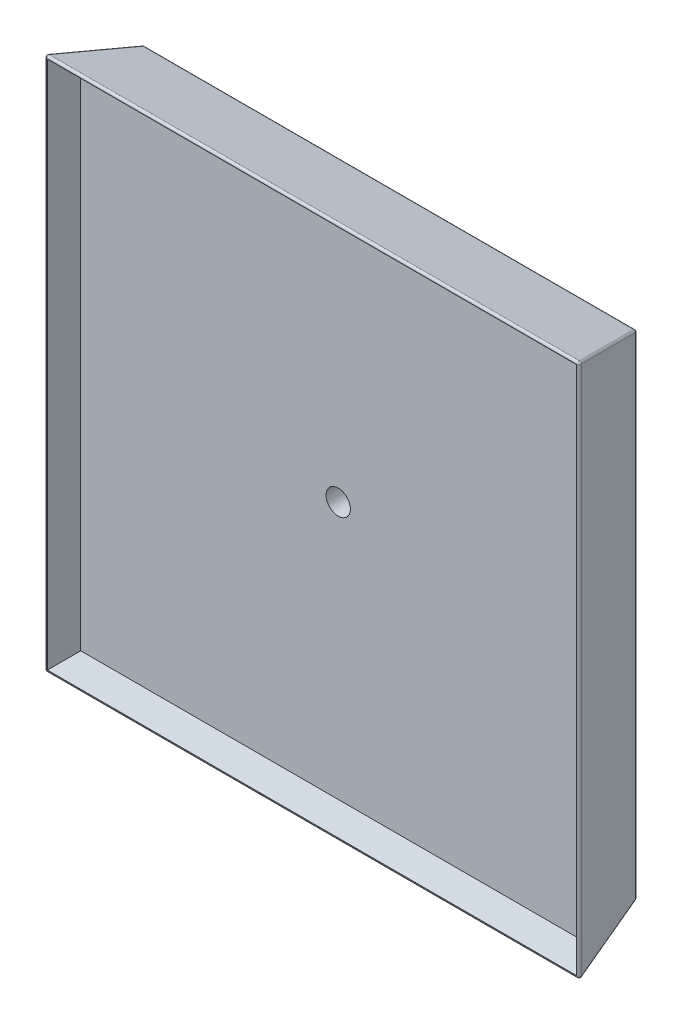
from build123d import *

# Parameters (mm, degrees)
SKETCH_1_W               = 550
SKETCH_1_H               = 550
EXTRUDE_1_DEPTH          = 80
DRAFT_3_ANGLE            = -15
FILLET_1_R               = 2
SHELL_8_OUTLINE_W        = 502.524167284
SHELL_8_OUTLINE_H        = 502.524167284
SHELL_8_DEPTH            = 77
SHELL_8_DRAFT            = -15
SKETCH_4_W               = 502.524167284
SKETCH_4_H               = 502.524167284
EXTRUDE_3_DEPTH          = 50
EXTRUDE_3_DRAFT          = -15
CUT_EXTRUDE_1_DEPTH      = 782.067566811
CUT_EXTRUDE_1_DEPTH_BACK = 782.067566811
SKETCH_5_R               = 12.5


# Read off the part's stored shape, not the designer's step: 쉘8
with BuildPart() as part:
    # 스케치1 → 보스-돌출1 (new body)
    with BuildSketch(Plane.XY):
        with Locations((275, -275)):
            Rectangle(SKETCH_1_W, SKETCH_1_H)
    extrude(amount=EXTRUDE_1_DEPTH)

    # 구배3
    draft_3_faces = [part.faces().sort_by_distance(p)[0] for p in [
        (550, -275, 40),
        (275, -550, 40),
        (0, -275, 40),
        (275, 0, 40),
    ]]
    draft(draft_3_faces, Plane.XY.offset(80), DRAFT_3_ANGLE)

    # 필렛1
    fillet_1_edges = [part.edges().sort_by_distance(p)[0] for p in [
        (550, -275, 80),
        (275, 0, 80),
        (0, -275, 80),
        (275, -21.435935394, 0),
        (528.564064606, -275, 0),
        (275, -528.564064606, 0),
        (21.435935394, -275, 0),
        (275, -550, 80),
        (10.717967697, -10.717967697, 40),
        (539.282032303, -10.717967697, 40),
        (539.282032303, -539.282032303, 40),
        (10.717967697, -539.282032303, 40),
    ]]
    fillet(fillet_1_edges, radius=FILLET_1_R)


with BuildPart() as shell_8_tool:
    # 쉘8 outline → 쉘8 (with draft: the straight prism first)
    with BuildSketch(Plane.XY.offset(3)):
        with Locations((275, -275)):
            Rectangle(SHELL_8_OUTLINE_W, SHELL_8_OUTLINE_H)
    extrude(amount=SHELL_8_DEPTH)
    # 쉘8: the draft: its side faces are tilted about the plane it starts from
    shell_8_sides = [shell_8_tool.faces().sort_by_distance(p)[0] for p in [
        (275, -526.262083642, 41.5),
        (526.262083642, -275, 41.5),
        (275, -23.737916358, 41.5),
        (23.737916358, -275, 41.5),
    ]]
    draft(shell_8_sides, Plane.XY.offset(3), SHELL_8_DRAFT)


with BuildPart() as part_1:
    add(part.part)

    # 쉘8: cut by shell_8_tool
    add(shell_8_tool.part, mode=Mode.SUBTRACT)


with BuildPart() as body_2:
    # 스케치4 → 보스-돌출3 (with draft: the straight prism first)
    with BuildSketch(Plane.XY.offset(3)):
        with Locations((275, -275)):
            Rectangle(SKETCH_4_W, SKETCH_4_H)
    extrude(amount=EXTRUDE_3_DEPTH)
    # 보스-돌출3: the draft: its side faces are tilted about the plane it starts from
    extrude_3_sides = [body_2.faces().sort_by_distance(p)[0] for p in [
        (526.262083642, -275, 28),
        (275, -23.737916358, 28),
        (23.737916358, -275, 28),
        (275, -526.262083642, 28),
    ]]
    draft(extrude_3_sides, Plane.XY.offset(3), EXTRUDE_3_DRAFT)


with BuildPart() as cut_extrude_1_tool:
    # 스케치5 → 컷-돌출1 (new, two sides: drawn at the far end of the back side and taken through both)
    with BuildSketch(Plane(origin=(0, 0, 0), x_dir=(-1, 0, 0), z_dir=(0, 0, -1)).offset(-CUT_EXTRUDE_1_DEPTH_BACK)):
        with Locations(Location((-274.97058937, -274.97058937, 0), (0, 0, 180))):
            Circle(SKETCH_5_R)
    extrude(amount=CUT_EXTRUDE_1_DEPTH + CUT_EXTRUDE_1_DEPTH_BACK)


with BuildPart() as part_2:
    add(part_1.part)

    # 컷-돌출1: cut by cut_extrude_1_tool
    add(cut_extrude_1_tool.part, mode=Mode.SUBTRACT)


with BuildPart() as body_2_1:
    add(body_2.part)

    # 컷-돌출1: cut by cut_extrude_1_tool
    add(cut_extrude_1_tool.part, mode=Mode.SUBTRACT)


solid = Compound([part_2.part, body_2_1.part])
